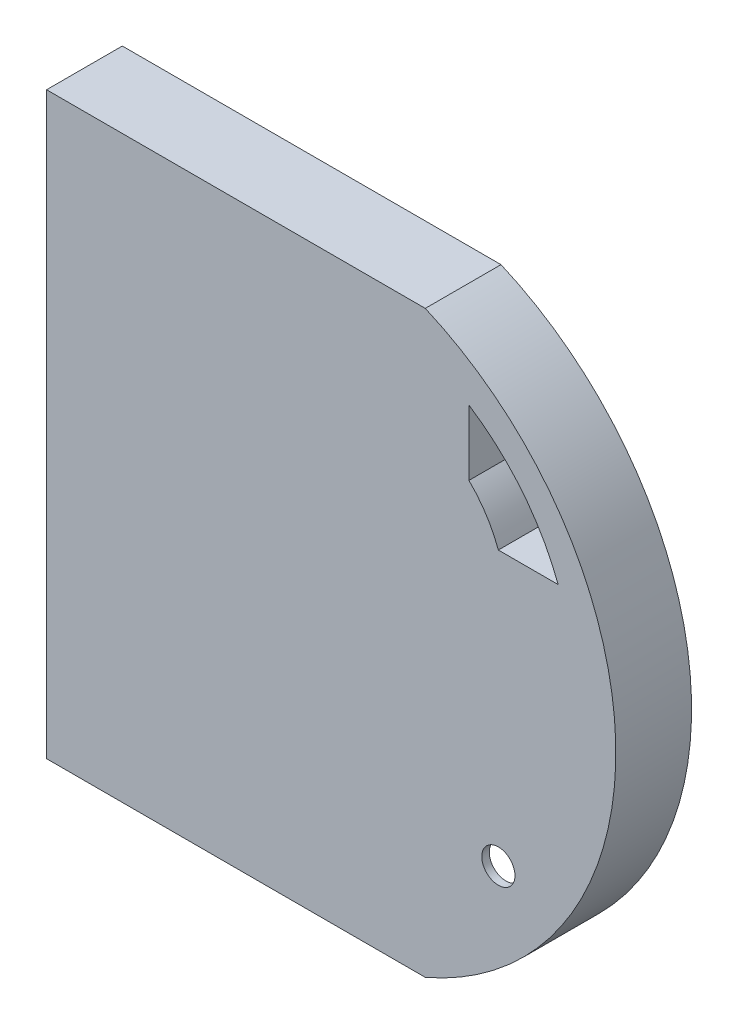
from build123d import *

# Parameters (mm, degrees)
BOSS_EXTRUDE1_DEPTH        = 0.5
BOSS_EXTRUDE1_DEPTH_BACK   = 0.0001
SKETCH1_W                  = 25
SKETCH1_H                  = 40
BOSS_EXTRUDE5_DEPTH        = 5.6
BOSS_EXTRUDE5_DEPTH_BACK   = 0.1
CUT_EXTRUDE2_DEPTH         = 5.033895825
CUT_EXTRUDE2_DEPTH_BACK    = 1
CUT_EXTRUDE3_DEPTH         = 0.5
BOSS_EXTRUDE7_DEPTH        = 5
BOSS_EXTRUDE7_DEPTH_BACK   = 1
BOSS_EXTRUDE7_2_DEPTH      = 5
BOSS_EXTRUDE7_2_DEPTH_BACK = 1
CUT_EXTRUDE4_DEPTH         = 0.4
CUT_EXTRUDE7_DEPTH         = 5
CUT_EXTRUDE7_DEPTH_BACK    = 6.2
SKETCH29_R                 = 1.25
CUT_EXTRUDE10_DEPTH        = 12
CUT_EXTRUDE10_DEPTH_BACK   = 3.2
BOSS_EXTRUDE15_DEPTH       = 5.134
BOSS_EXTRUDE15_DEPTH_BACK  = 0.5
SKETCH42_W                 = 1.9
SKETCH42_H                 = 1
BOSS_EXTRUDE21_DEPTH       = 2.001
BOSS_EXTRUDE22_DEPTH       = 1.9


with BuildPart() as part:
    # Sketch1 → Boss-Extrude1 (new, two sides: drawn at the far end of the back side and taken through both)
    with BuildSketch(Plane.XY.offset(-BOSS_EXTRUDE1_DEPTH_BACK)):
        with Locations((-61.729654626, 25.727532329)):
            Rectangle(SKETCH1_W, SKETCH1_H)
    extrude(amount=BOSS_EXTRUDE1_DEPTH + BOSS_EXTRUDE1_DEPTH_BACK)

    # Sketch2 → Boss-Extrude5 (add, two sides: drawn at the far end of the back side and taken through both)
    with BuildSketch(Plane.XY.offset(-BOSS_EXTRUDE5_DEPTH_BACK)):
        with BuildLine():
            Line((-49.388759409, 47.527532329), (-77.888759409, 47.527532329))
            Line((-77.888759409, 47.527532329), (-77.888759409, 3.927532329))
            Line((-77.888759409, 3.927532329), (-49.388759409, 3.927532329))
            ThreePointArc((-49.388759409, 3.927532329), (-35.047275566, 25.727532329), (-49.388759409, 47.527532329))
        make_face()
    extrude(amount=BOSS_EXTRUDE5_DEPTH + BOSS_EXTRUDE5_DEPTH_BACK)

    # Sketch8 → Cut-Extrude2 (cut, two sides: drawn at the far end of the back side and taken through both)
    with BuildSketch(Plane.XY.offset(-CUT_EXTRUDE2_DEPTH_BACK)):
        with BuildLine():
            Line((-76.888759409, 46.527532329), (-76.888759409, 4.927532329))
            Line((-76.888759409, 4.927532329), (-49.388759409, 4.927532329))
            ThreePointArc((-49.388759409, 4.927532329), (-36.047275566, 25.727532329), (-49.388759409, 46.527532329))
            Line((-49.388759409, 46.527532329), (-76.888759409, 46.527532329))
        make_face()
    extrude(amount=CUT_EXTRUDE2_DEPTH + CUT_EXTRUDE2_DEPTH_BACK, mode=Mode.SUBTRACT)

    # Sketch11 → Cut-Extrude3 (cut)
    with BuildSketch(Plane(origin=(0, 0, -0.1), x_dir=(-1, 0, 0), z_dir=(0, 0, -1))):
        with BuildLine():
            Line((49.388759409, 4.427532329), (77.388759409, 4.427532329))
            Line((77.388759409, 4.427532329), (77.388759409, 47.027532329))
            Line((77.388759409, 47.027532329), (49.388759409, 47.027532329))
            ThreePointArc((49.388759409, 47.027532329), (35.547275566, 25.727532329), (49.388759409, 4.427532329))
        make_face()
    extrude(amount=-CUT_EXTRUDE3_DEPTH, mode=Mode.SUBTRACT)

    # Sketch17 → Cut-Extrude4 (cut)
    with BuildSketch(Plane.ZY.offset(77.888759409)):
        Polygon((-3.1, 25.727532329), (-3.1, 28.727532329), (2.9, 25.727532329), (-3.1, 22.727532329), align=None)
    extrude(amount=-CUT_EXTRUDE4_DEPTH, mode=Mode.SUBTRACT)

    # Sketch29 → Cut-Extrude7 (cut, two sides: drawn at the far end of the back side and taken through both)
    with BuildSketch(Plane(origin=(0, 0, 5.033895825), x_dir=(-1, 0, 0), z_dir=(0, 0, -1)).offset(-CUT_EXTRUDE7_DEPTH_BACK)):
        with Locations((43.888759409, 13.927532329)):
            Circle(SKETCH29_R)
    extrude(amount=CUT_EXTRUDE7_DEPTH + CUT_EXTRUDE7_DEPTH_BACK, mode=Mode.SUBTRACT)

    # Sketch18 → Cut-Extrude10 (cut, two sides: drawn at the far end of the back side and taken through both)
    with BuildSketch(Plane(origin=(0, 0, 5.033895825), x_dir=(-1, 0, 0), z_dir=(0, 0, -1)).offset(-CUT_EXTRUDE10_DEPTH_BACK)):
        with BuildLine():
            Line((39.388759409, 34.527532329), (43.888759409, 34.527532329))
            ThreePointArc((43.888759409, 34.527532329), (44.802883542, 36.367424467), (46.102233885, 37.958812132))
            Line((46.102233885, 37.958812132), (46.102233885, 42.864556241))
            ThreePointArc((46.102233885, 42.864556241), (42.079276528, 39.232524906), (39.388759409, 34.527532329))
        make_face()
    extrude(amount=CUT_EXTRUDE10_DEPTH + CUT_EXTRUDE10_DEPTH_BACK, mode=Mode.SUBTRACT)

    # Sketch38 → Boss-Extrude15 (add, two sides: drawn at the far end of the back side and taken through both)
    with BuildSketch(Plane(origin=(0, 0, 5.033895825), x_dir=(-1, 0, 0), z_dir=(0, 0, -1)).offset(-BOSS_EXTRUDE15_DEPTH_BACK)):
        with BuildLine():
            ThreePointArc((46.602233885, 43.614556241), (41.841207095, 39.553364286), (38.872169612, 34.044691795))
            Line((38.872169612, 34.044691795), (39.388759409, 34.044691795))
            Line((39.388759409, 34.044691795), (43.888759409, 34.044691795))
            Line((43.888759409, 34.044691795), (44.405349206, 34.044691795))
            ThreePointArc((44.405349206, 34.044691795), (45.269831112, 36.017026857), (46.602233885, 37.708812132))
            Line((46.602233885, 37.708812132), (46.602233885, 37.958812132))
            Line((46.602233885, 37.958812132), (46.602233885, 42.864556241))
            Line((46.602233885, 42.864556241), (46.602233885, 43.614556241))
        make_face()
        with BuildLine():
            Line((46.102233885, 42.864556241), (46.102233885, 37.958812132))
            ThreePointArc((46.102233885, 37.958812132), (44.802883542, 36.367424467), (43.888759409, 34.527532329))
            Line((43.888759409, 34.527532329), (39.388759409, 34.527532329))
            ThreePointArc((39.388759409, 34.527532329), (42.079276528, 39.232524906), (46.102233885, 42.864556241))
        make_face(mode=Mode.SUBTRACT)
    extrude(amount=BOSS_EXTRUDE15_DEPTH + BOSS_EXTRUDE15_DEPTH_BACK)

    # Sketch42 → Boss-Extrude21 (add)
    with BuildSketch(Plane.ZY.offset(77.888759409)):
        with Locations((1.35, 11.827532329)):
            Rectangle(SKETCH42_W, SKETCH42_H)
        with Locations((1.35, 17.327532329)):
            Rectangle(SKETCH42_W, SKETCH42_H)
    extrude(amount=-BOSS_EXTRUDE21_DEPTH)

    # Sketch49 → Boss-Extrude22 (add)
    with BuildSketch(Plane(origin=(0, 0, 0.4), x_dir=(-1, 0, 0), z_dir=(0, 0, -1))):
        Polygon((75.887759409, 17.827532329), (74.887759409, 17.827532329), (74.887759409, 11.694928306), (74.887759409, 11.327532329), (75.887759409, 11.327532329), align=None)
    extrude(amount=-BOSS_EXTRUDE22_DEPTH)


with BuildPart() as body_2:
    # Sketch9 → Boss-Extrude7 (new, two sides: drawn at the far end of the back side and taken through both)
    with BuildSketch(Plane.XY.offset(-BOSS_EXTRUDE7_DEPTH_BACK)):
        with BuildLine():
            Line((-37.709306063, 30.262523401), (-37.709306063, 29.391558822))
            ThreePointArc((-37.709306063, 29.391558822), (-42.003219762, 31.714307994), (-46.602233885, 30.07664879))
            Line((-46.602233885, 30.07664879), (-46.602233885, 30.974503727))
            ThreePointArc((-46.602233885, 30.974503727), (-42.015807763, 32.36669928), (-37.709306063, 30.262523401))
        make_face()
    extrude(amount=BOSS_EXTRUDE7_DEPTH + BOSS_EXTRUDE7_DEPTH_BACK)


with BuildPart() as body_3:
    # Sketch9 → Boss-Extrude7 2 (new, two sides: drawn at the far end of the back side and taken through both)
    with BuildSketch(Plane.XY.offset(-BOSS_EXTRUDE7_2_DEPTH_BACK)):
        with BuildLine():
            Line((-37.709306063, 22.074162076), (-37.709306063, 21.227989818))
            ThreePointArc((-37.709306063, 21.227989818), (-42.041689553, 19.191758771), (-46.602233885, 20.64682543))
            Line((-46.602233885, 20.64682543), (-46.602233885, 21.378415869))
            ThreePointArc((-46.602233885, 21.378415869), (-42.000825501, 19.745811029), (-37.709306063, 22.074162076))
        make_face()
    extrude(amount=BOSS_EXTRUDE7_2_DEPTH + BOSS_EXTRUDE7_2_DEPTH_BACK)


solid = Compound([part.part, body_2.part, body_3.part])
